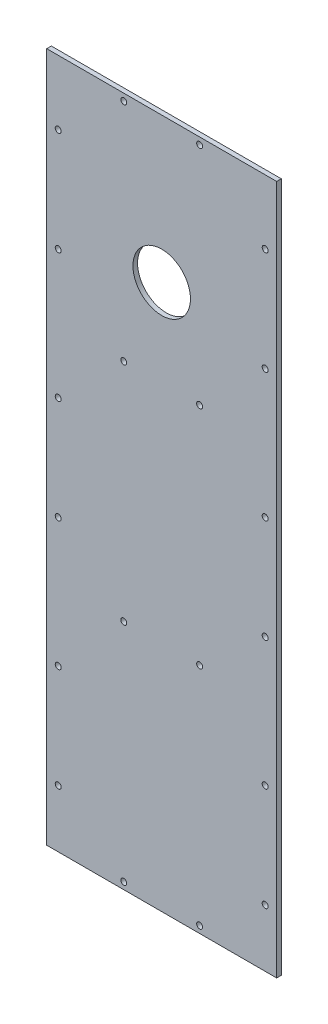
from build123d import *

# Parameters (mm, degrees)
SKETCH1_W           = 100
SKETCH1_H           = 300
BOSS_EXTRUDE1_DEPTH = 2
SKETCH2_R           = 1.3
CUT_EXTRUDE1_DEPTH  = 10
SKETCH3_R           = 12.5
CUT_EXTRUDE2_DEPTH  = 10


with BuildPart() as part:
    # Sketch1 → Boss-Extrude1 (new body)
    with BuildSketch(Plane.XY):
        Rectangle(SKETCH1_W, SKETCH1_H)
    extrude(amount=BOSS_EXTRUDE1_DEPTH)

    # Sketch2 → Cut-Extrude1 (cut)
    with BuildSketch(Plane.XY.offset(2)):
        with Locations((-45, 122)):
            Circle(SKETCH2_R)
        with Locations((-45, 77)):
            Circle(SKETCH2_R)
        with Locations((45, 122)):
            Circle(SKETCH2_R)
        with Locations((45, 77)):
            Circle(SKETCH2_R)
        with Locations((-45, 21)):
            Circle(SKETCH2_R)
        with Locations((-45, -24)):
            Circle(SKETCH2_R)
        with Locations((45, 21)):
            Circle(SKETCH2_R)
        with Locations((45, -24)):
            Circle(SKETCH2_R)
        with Locations((-45, -80)):
            Circle(SKETCH2_R)
        with Locations((-45, -125)):
            Circle(SKETCH2_R)
        with Locations((45, -80)):
            Circle(SKETCH2_R)
        with Locations((45, -125)):
            Circle(SKETCH2_R)
        with Locations((16.5, -147)):
            Circle(SKETCH2_R)
        with Locations((-16.5, -147)):
            Circle(SKETCH2_R)
        with Locations((-16.5, -49)):
            Circle(SKETCH2_R)
        with Locations((16.5, -49)):
            Circle(SKETCH2_R)
        with Locations((-16.5, 49)):
            Circle(SKETCH2_R)
        with Locations((16.5, 49)):
            Circle(SKETCH2_R)
        with Locations((-16.5, 147)):
            Circle(SKETCH2_R)
        with Locations((16.5, 147)):
            Circle(SKETCH2_R)
    extrude(amount=-CUT_EXTRUDE1_DEPTH, mode=Mode.SUBTRACT)

    # Sketch3 → Cut-Extrude2 (cut)
    with BuildSketch(Plane(origin=(0, 0, 0), x_dir=(-1, 0, 0), z_dir=(0, 0, -1))):
        with Locations((0, 87)):
            Circle(SKETCH3_R)
    extrude(amount=-CUT_EXTRUDE2_DEPTH, mode=Mode.SUBTRACT)


solid = part.part
